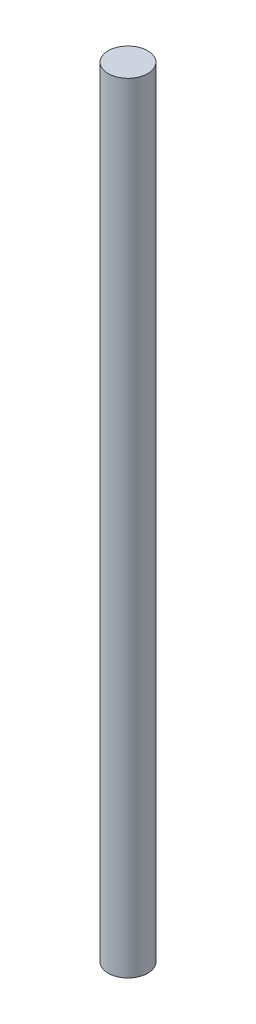
from build123d import *

# Parameters (mm, degrees)
SKETCH1_R           = 12.7
BOSS_EXTRUDE1_DEPTH = 500


with BuildPart() as part:
    # Sketch1 → Boss-Extrude1 (new body)
    with BuildSketch(Plane(origin=(0, 0, 0), x_dir=(1, 0, 0), z_dir=(0, 1, 0))):
        Circle(SKETCH1_R)
    extrude(amount=BOSS_EXTRUDE1_DEPTH)


solid = part.part
